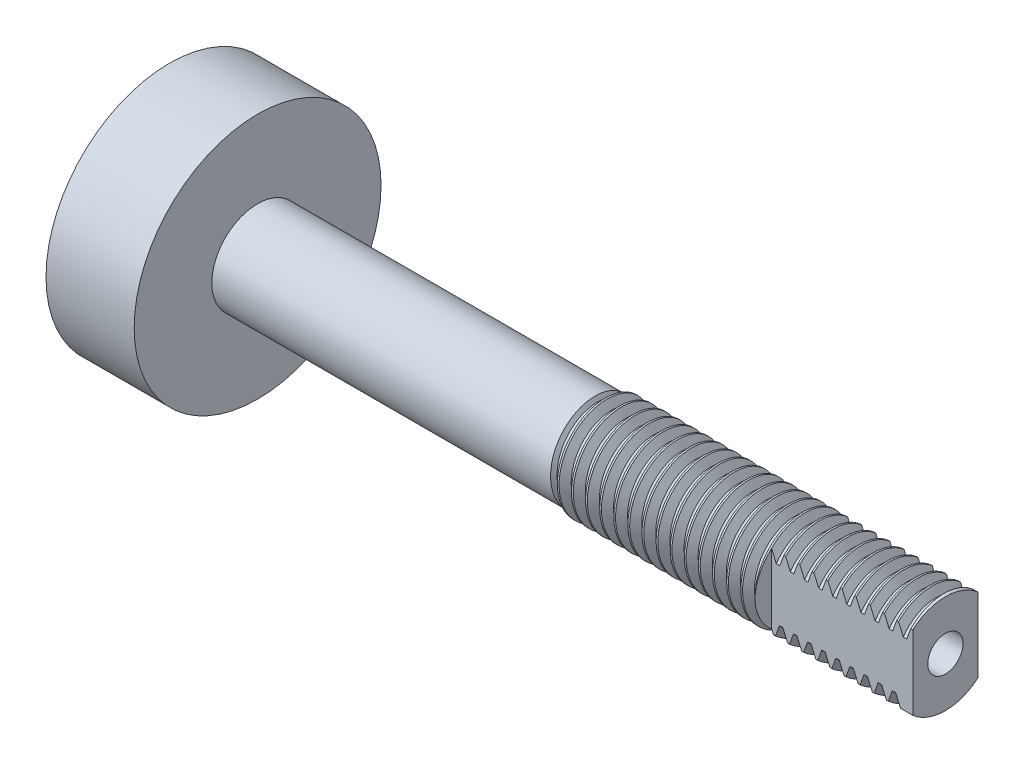
from build123d import *

# Parameters (mm, degrees)
SKETCH1_R           = 2.8
BOSS_EXTRUDE1_DEPTH = 19.5
CUT_EXTRUDE1_DEPTH  = 8
SKETCH3_R           = 1
CUT_EXTRUDE2_DEPTH  = 6
SKETCH5_R           = 7
BOSS_EXTRUDE2_DEPTH = 5
SKETCH7_R           = 2.9
SKETCH7_R_2         = 2.6
CUT_EXTRUDE3_DEPTH  = 19.5
THREAD1_PITCH       = 0.8


with BuildPart() as part:
    # Sketch1 → Boss-Extrude1 (new, symmetric)
    with BuildSketch(Plane(origin=(0, 0, 0), x_dir=(0, 0, -1), z_dir=(1, 0, 0))):
        Circle(SKETCH1_R)
    extrude(amount=BOSS_EXTRUDE1_DEPTH, both=True)

    # Sketch2 → Cut-Extrude1 (cut)
    with BuildSketch(Plane(origin=(19.5, 0, 0), x_dir=(0, 0, -1), z_dir=(1, 0, 0))):
        with BuildLine():
            Line((-1.85, 2.101784956), (-1.85, -2.101784956))
            ThreePointArc((-1.85, -2.101784956), (-2.8, 0), (-1.85, 2.101784956))
        make_face()
        with BuildLine():
            Line((1.85, 2.101784956), (1.85, -2.101784956))
            ThreePointArc((1.85, -2.101784956), (2.8, 0), (1.85, 2.101784956))
        make_face()
    extrude(amount=-CUT_EXTRUDE1_DEPTH, mode=Mode.SUBTRACT)

    # Sketch3 → Cut-Extrude2 (cut)
    with BuildSketch(Plane(origin=(19.5, 0, 0), x_dir=(0, 0, -1), z_dir=(1, 0, 0))):
        Circle(SKETCH3_R)
    extrude(amount=-CUT_EXTRUDE2_DEPTH, mode=Mode.SUBTRACT)

    # Sketch5 → Boss-Extrude2 (add)
    with BuildSketch(Plane.ZY.offset(19.5)):
        Circle(SKETCH5_R)
    extrude(amount=BOSS_EXTRUDE2_DEPTH)

    # Sketch7 → Cut-Extrude3 (cut)
    with BuildSketch(Plane(origin=(0, 0, 0), x_dir=(0, 0, -1), z_dir=(1, 0, 0))):
        Circle(SKETCH7_R)
        Circle(SKETCH7_R_2, mode=Mode.SUBTRACT)
    extrude(amount=-CUT_EXTRUDE3_DEPTH, mode=Mode.SUBTRACT)

    # Thread1: the profile of Thread Profile1 profile screwed along a right-hand helix of 24.375 turns, 8 arcs to a turn; built about Z, then put on its axis
    thread1_z = Axis((0, 0, 0), (0, 0, 1))
    thread1_corners = [(2.8003, 0, -0.000173205), (2.8003, 0, 0.700173203), (2.3669873, 0, 0.449999999), (2.3669873, 0, 0.249999999)]
    with BuildLine(mode=Mode.PRIVATE) as thread1_profile:
        Line(thread1_corners[0], thread1_corners[1])
        Line(thread1_corners[1], thread1_corners[2])
        Line(thread1_corners[2], thread1_corners[3])
        Line(thread1_corners[3], thread1_corners[0])
    thread1_cap = Face(thread1_profile.wire())
    thread1_turn_angles = [0, 22.5, 45, 67.5, 90, 112.5, 135, 157.5, 180, 202.5, 225, 247.5, 270, 292.5, 315, 337.5, 360]
    thread1_turn_weights = [1, 0.9238795325112867, 1, 0.9238795325112867, 1, 0.9238795325112867, 1, 0.9238795325112867, 1, 0.9238795325112867, 1, 0.9238795325112867, 1, 0.9238795325112867, 1, 0.9238795325112867, 1]
    thread1_turn_rails = [Edge.make_bspline([Vector(p[0], p[1], 0).rotate(thread1_z, thread1_turn_angles[k]) / thread1_turn_weights[k] + Vector(0, 0, p[2] + THREAD1_PITCH * thread1_turn_angles[k] / 360) for k in range(17)], [0, 0, 0, 1, 1, 2, 2, 3, 3, 4, 4, 5, 5, 6, 6, 7, 7, 8, 8, 8], 2, thread1_turn_weights) for p in thread1_corners]
    thread1_turn_sides = [Face.make_surface_from_curves(thread1_turn_rails[p[0]], thread1_turn_rails[p[1]]) for p in [(0, 1), (1, 2), (2, 3), (3, 0)]]
    thread1_last_angles = [8640, 8662.5, 8685, 8707.5, 8730, 8752.5, 8775]
    thread1_last_weights = [1, 0.9238795325112867, 1, 0.9238795325112867, 1, 0.9238795325112867, 1]
    thread1_last_rails = [Edge.make_bspline([Vector(p[0], p[1], 0).rotate(thread1_z, thread1_last_angles[k]) / thread1_last_weights[k] + Vector(0, 0, p[2] + THREAD1_PITCH * thread1_last_angles[k] / 360) for k in range(7)], [0, 0, 0, 1, 1, 2, 2, 3, 3, 3], 2, thread1_last_weights) for p in thread1_corners]
    thread1_last_sides = [Face.make_surface_from_curves(thread1_last_rails[p[0]], thread1_last_rails[p[1]]) for p in [(0, 1), (1, 2), (2, 3), (3, 0)]]
    thread1 = Plane(origin=(19.5, 0, 0), x_dir=(0, 0, 1), z_dir=(-1, 0, 0)) * Solid(Shell([*[p.moved(Location((0, 0, THREAD1_PITCH * i))) for i in range(24) for p in thread1_turn_sides], *thread1_last_sides, thread1_cap, thread1_cap.rotate(thread1_z, 8775).moved(Location((0, 0, THREAD1_PITCH * 8775 / 360)))]))
    add(thread1, mode=Mode.SUBTRACT)


solid = part.part
